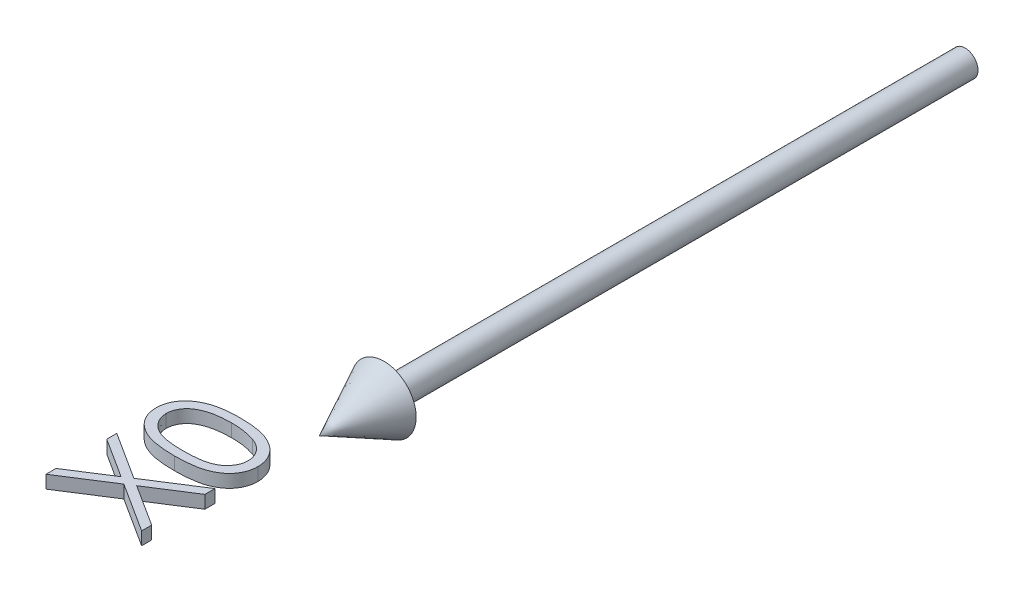
from build123d import *

# Parameters (mm, degrees)
BOSS_EXTRUDE1_DEPTH        = 1
BOSS_EXTRUDE1_DEPTH_BACK   = 1
BOSS_EXTRUDE1_2_DEPTH      = 1
BOSS_EXTRUDE1_2_DEPTH_BACK = 1


with BuildPart() as part:
    # Sketch2 → Revolve1 (revolve)
    with BuildSketch(Plane(origin=(0, 0, 0), x_dir=(1, 0, 0), z_dir=(0, 1, 0))):
        Polygon((0, -100), (5, -90), (2, -90), (2, 0), (0, 0), align=None)
    revolve(axis=Axis((0, 0, -41.949952025), (0, 0, 1)))


with BuildPart() as body_2:
    # Sketch3 → Boss-Extrude1 (new, two sides: drawn at the far end of the back side and taken through both)
    with BuildSketch(Plane(origin=(0, 0, 0), x_dir=(1, 0, 0), z_dir=(0, 1, 0)).offset(-BOSS_EXTRUDE1_DEPTH_BACK)):
        with BuildLine():
            add(Edge.make_bspline(
                [(-7.493990385, -114.91434242), (-7.734407761, -114.912936628), (-8.201421979, -114.910205857), (-8.881927587, -114.879826909), (-9.520328827, -114.829361158), (-10.11665625, -114.760200985), (-10.671063822, -114.676038223), (-11.182069889, -114.563686105), (-11.652039749, -114.43591706), (-12.082505278, -114.287834783), (-12.479268217, -114.12074552), (-12.849657159, -113.938879953), (-13.193139524, -113.735046612), (-13.515098063, -113.520803437), (-13.810615561, -113.287809968), (-14.08309694, -113.041062029), (-14.330244312, -112.775624624), (-14.552226925, -112.494072257), (-14.746873286, -112.198313137), (-14.919380346, -111.896429253), (-15.061473493, -111.583026614), (-15.177709598, -111.262230989), (-15.272595813, -110.933366262), (-15.337772922, -110.596516388), (-15.378709332, -110.250900526), (-15.382628022, -110.017624316), (-15.384615385, -109.899318382)],
                knots=[0, 0, 0, 0, 1.646148282, 3.197666765, 4.66315463, 6.030252048, 7.307778049, 8.501004361, 9.610818041, 10.641065266, 11.615491391, 12.557119604, 13.464013759, 14.348536654, 15.203310953, 16.038349431, 16.863300206, 17.683791446, 18.490318933, 19.285717724, 20.06220424, 20.843281102, 21.620494212, 22.403315558, 23.190242141, 24, 24, 24, 24], degree=3))
            add(Edge.make_bspline(
                [(-15.384615385, -109.899318382), (-15.382960028, -109.77996562), (-15.379666451, -109.542495631), (-15.33330737, -109.192673567), (-15.273470363, -108.848944807), (-15.177501658, -108.516524394), (-15.062662656, -108.189126898), (-14.911134418, -107.874894038), (-14.746335691, -107.562731732), (-14.545295108, -107.266821095), (-14.323112179, -106.978320858), (-14.070877754, -106.707882008), (-13.795572446, -106.448591405), (-13.491056145, -106.210242353), (-13.161997985, -105.982619543), (-12.805639513, -105.774363767), (-12.422770469, -105.581143684), (-12.015165777, -105.39932727), (-11.571937683, -105.240333617), (-11.095850718, -105.09897555), (-10.582593685, -104.983108696), (-10.035025751, -104.887288845), (-9.450434272, -104.8129144), (-8.830003698, -104.758785937), (-8.173345879, -104.730183749), (-7.724383527, -104.724798345), (-7.493990385, -104.722034728)],
                knots=[0, 0, 0, 0, 0.810910589, 1.61342667, 2.396193133, 3.181089899, 3.963115317, 4.752255436, 5.550715454, 6.36105385, 7.181178335, 8.024612154, 8.872680183, 9.750181803, 10.651284446, 11.591556747, 12.554036451, 13.566402641, 14.62422919, 15.753422176, 16.94128843, 18.199818041, 19.531985927, 20.947085226, 22.433341622, 24, 24, 24, 24], degree=3))
            add(Edge.make_bspline(
                [(-7.493990385, -104.722034728), (-7.264604216, -104.724859146), (-6.816654145, -104.730374729), (-6.162920169, -104.758172499), (-5.545833851, -104.814236509), (-4.964737284, -104.883342455), (-4.419361049, -104.980233276), (-3.910060515, -105.096978702), (-3.435032524, -105.229992754), (-2.99768059, -105.391426532), (-2.590783215, -105.569011021), (-2.210729382, -105.762023764), (-1.854465021, -105.969104319), (-1.524538919, -106.193313316), (-1.221244895, -106.435582967), (-0.944995341, -106.694691831), (-0.691156597, -106.967491929), (-0.466525872, -107.257674071), (-0.263954666, -107.556340934), (-0.093175488, -107.868534955), (0.054794652, -108.186266248), (0.175773888, -108.512707057), (0.2695947, -108.847353376), (0.334091398, -109.19131773), (0.379427623, -109.542544997), (0.382880143, -109.779982132), (0.384615385, -109.899318382)],
                knots=[0, 0, 0, 0, 1.561645053, 3.049612875, 4.452756685, 5.778837748, 7.032101753, 8.221335837, 9.334924186, 10.387562255, 11.392109817, 12.355697819, 13.287721948, 14.19548756, 15.068665045, 15.927346723, 16.771751757, 17.602390507, 18.423119567, 19.225778204, 20.022010933, 20.807278863, 21.593079439, 22.384715467, 23.188155646, 24, 24, 24, 24], degree=3))
            add(Edge.make_bspline(
                [(0.384615385, -109.899318382), (0.382616718, -110.017621727), (0.378675738, -110.250892833), (0.337902604, -110.596546086), (0.272350445, -110.932042269), (0.180565008, -111.259036942), (0.068215675, -111.57920767), (-0.078157124, -111.888191949), (-0.246732198, -112.189424149), (-0.438710698, -112.482105027), (-0.658667943, -112.760717951), (-0.901916131, -113.026895305), (-1.174692968, -113.273704092), (-1.472703873, -113.504677298), (-1.795141429, -113.721185408), (-2.142222022, -113.92325736), (-2.514538298, -114.108936787), (-2.91443689, -114.27888074), (-3.347957668, -114.429555016), (-3.819125522, -114.562133667), (-4.332726118, -114.668020164), (-4.886151799, -114.757775339), (-5.480527086, -114.829697336), (-6.116067016, -114.879805953), (-6.791564752, -114.910182794), (-7.255575818, -114.912930576), (-7.493990385, -114.91434242)],
                knots=[0, 0, 0, 0, 0.810927267, 1.598990287, 2.382942141, 3.152806972, 3.926217614, 4.706701772, 5.493896336, 6.292070767, 7.104102563, 7.925577746, 8.761822141, 9.623241997, 10.509042271, 11.423174113, 12.375371989, 13.360203808, 14.400680605, 15.520553799, 16.714061498, 17.994519714, 19.364400916, 20.818312473, 22.365209998, 24, 24, 24, 24], degree=3))
        make_face()
        with BuildLine():
            add(Edge.make_bspline(
                [(-7.5, -113.568188574), (-7.299649235, -113.567665433), (-6.91080774, -113.566650119), (-6.346752781, -113.540893372), (-5.819774782, -113.505042608), (-5.330079419, -113.459940283), (-4.879378162, -113.392393138), (-4.465797283, -113.315756772), (-4.090102312, -113.223836128), (-3.74901012, -113.11454123), (-3.437690705, -112.990043703), (-3.147846302, -112.854352946), (-2.876041714, -112.707290786), (-2.622936378, -112.545842772), (-2.391624229, -112.36681696), (-2.176242033, -112.178513012), (-1.984280592, -111.972447935), (-1.754014466, -111.687444569), (-1.516079182, -111.311167981), (-1.308880488, -110.837082123), (-1.178670253, -110.349931165), (-1.16211126, -110.01928301), (-1.153846154, -109.854246266)],
                knots=[0, 0, 0, 0, 1.459098681, 2.831824031, 4.11146945, 5.306290378, 6.412266529, 7.42953815, 8.369053297, 9.227277979, 10.03601793, 10.809473603, 11.557037441, 12.285528272, 12.993193355, 13.685654407, 14.36688038, 15.041354379, 16.352855396, 17.594313975, 18.799247529, 20, 20, 20, 20], degree=3))
            add(Edge.make_bspline(
                [(-1.153846154, -109.854246266), (-1.161083242, -109.688254188), (-1.175531747, -109.356858841), (-1.301632605, -108.870155381), (-1.506632555, -108.401570439), (-1.740840139, -108.03176817), (-1.96531168, -107.751209888), (-2.156474594, -107.550120339), (-2.370583043, -107.365573354), (-2.601576726, -107.190534598), (-2.85388829, -107.029996062), (-3.126299066, -106.884011084), (-3.419567044, -106.750796766), (-3.624294488, -106.674900851), (-3.728966346, -106.636097228)],
                knots=[0, 0, 0, 0, 1.353621445, 2.702441307, 4.075953605, 5.516772412, 6.261413105, 7.007624062, 7.778524365, 8.566925914, 9.372323995, 10.217594641, 11.088702136, 12, 12, 12, 12], degree=3))
            add(Edge.make_bspline(
                [(-3.728966346, -106.636097228), (-3.862808087, -106.590875366), (-4.134564219, -106.499055592), (-4.556122728, -106.380719417), (-4.998420288, -106.287524849), (-5.458813645, -106.203681853), (-5.940698078, -106.14645447), (-6.442582581, -106.100392413), (-6.964845562, -106.073260898), (-7.319681238, -106.069897679), (-7.5, -106.068188574)],
                knots=[0, 0, 0, 0, 0.884706709, 1.796334032, 2.740027952, 3.714592787, 4.726048262, 5.777819803, 6.87074269, 8, 8, 8, 8], degree=3))
            add(Edge.make_bspline(
                [(-7.5, -106.068188574), (-7.680289597, -106.070546528), (-8.032974588, -106.07515919), (-8.549481077, -106.092790566), (-9.040057196, -106.13832017), (-9.506816361, -106.188887825), (-9.947174812, -106.263447334), (-10.364818942, -106.343837969), (-10.754574884, -106.451843046), (-11.122544099, -106.56721392), (-11.464548365, -106.699257052), (-11.782173829, -106.844615106), (-12.076983164, -106.999834056), (-12.348065488, -107.168503628), (-12.596993203, -107.348274426), (-12.818038495, -107.545592017), (-13.021954001, -107.747925275), (-13.250558341, -108.035685819), (-13.485487036, -108.40935164), (-13.695801559, -108.877525459), (-13.820271369, -109.362065178), (-13.837532574, -109.690304197), (-13.846153846, -109.854246266)],
                knots=[0, 0, 0, 0, 1.313483664, 2.569454835, 3.763100662, 4.901599063, 5.988328865, 7.015709358, 7.99797933, 8.932480776, 9.824041341, 10.666387587, 11.475829342, 12.24921787, 12.990555181, 13.709176526, 14.405678811, 15.080244297, 16.38186033, 17.610124501, 18.806354173, 20, 20, 20, 20], degree=3))
            add(Edge.make_bspline(
                [(-13.846153846, -109.854246266), (-13.837511125, -110.020174005), (-13.820209939, -110.352331764), (-13.696377194, -110.842045916), (-13.486102376, -111.313382531), (-13.251010958, -111.688280565), (-13.022830494, -111.972545301), (-12.828622647, -112.174266225), (-12.618384757, -112.365181692), (-12.385020606, -112.539571651), (-12.132807088, -112.700062325), (-11.864517407, -112.852807912), (-11.574131433, -112.986684127), (-11.263056133, -113.111581346), (-10.92194518, -113.221058546), (-10.544890815, -113.311928894), (-10.130322276, -113.394655601), (-9.676327937, -113.454232313), (-9.186528059, -113.506693565), (-8.658202405, -113.540499795), (-8.092210531, -113.566768111), (-7.701357234, -113.567705603), (-7.5, -113.568188574)],
                knots=[0, 0, 0, 0, 1.207546505, 2.417292871, 3.651582144, 4.952510111, 5.626719005, 6.30238548, 6.989136872, 7.692112372, 8.420316868, 9.164734959, 9.937886623, 10.746308695, 11.604196049, 12.543341915, 13.568754172, 14.680483261, 15.875568977, 17.154711427, 18.534182925, 20, 20, 20, 20], degree=3))
        make_face(mode=Mode.SUBTRACT)
    extrude(amount=BOSS_EXTRUDE1_DEPTH + BOSS_EXTRUDE1_DEPTH_BACK)


with BuildPart() as body_3:
    # Sketch3 → Boss-Extrude1 2 (new, two sides: drawn at the far end of the back side and taken through both)
    with BuildSketch(Plane(origin=(0, 0, 0), x_dir=(1, 0, 0), z_dir=(0, 1, 0)).offset(-BOSS_EXTRUDE1_2_DEPTH_BACK)):
        Polygon((-15, -127.318188574), (-15, -125.764702997), (-8.864182692, -121.837419343), (-15, -117.910135689), (-15, -116.356650112), (-7.650240385, -121.059174151), (0, -116.16434242), (0, -117.717827997), (-6.436298077, -121.837419343), (0, -125.957010689), (0, -127.510496266), (-7.650240385, -122.612659728), align=None)
    extrude(amount=BOSS_EXTRUDE1_2_DEPTH + BOSS_EXTRUDE1_2_DEPTH_BACK)


solid = Compound([part.part, body_2.part, body_3.part])
